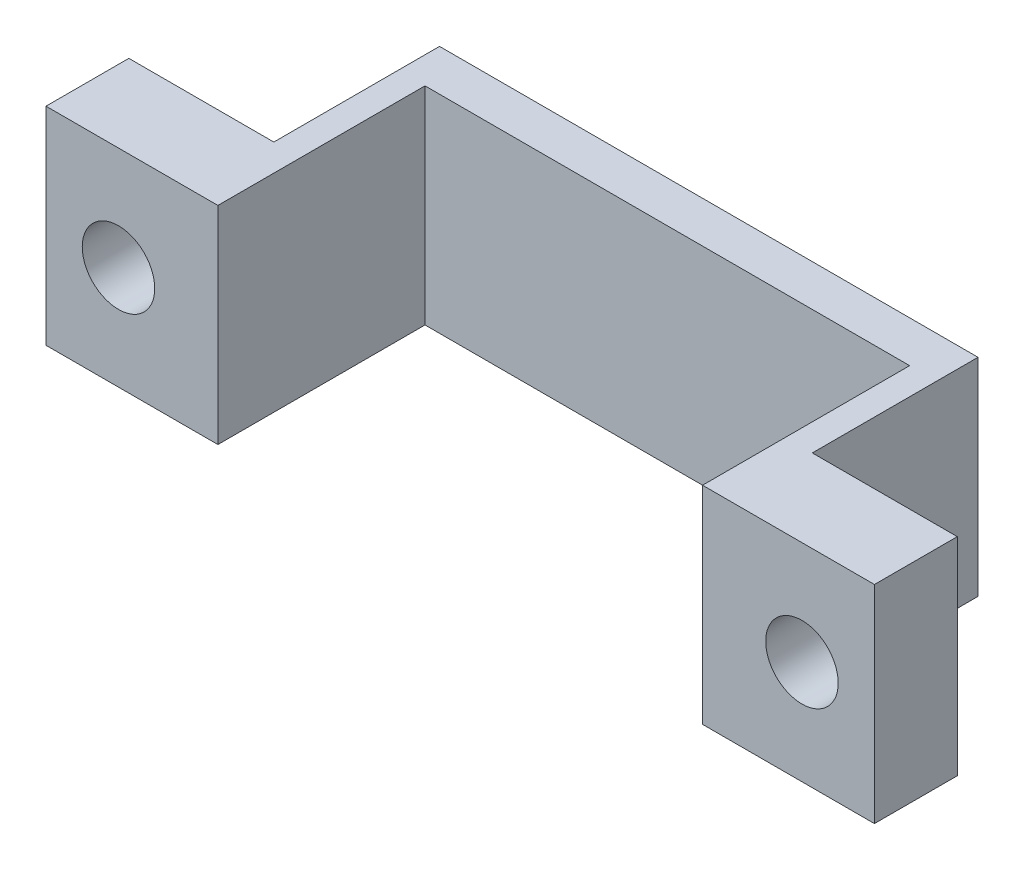
from build123d import *

# Parameters (mm, degrees)
EXTRUDE_1_DEPTH     = 10
SKETCH_3_R          = 1.75
CUT_EXTRUDE_2_DEPTH = 4


with BuildPart() as part:
    # Эскиз1 → Бобышка-Вытянуть1 (new body)
    with BuildSketch(Plane(origin=(0, 0, 0), x_dir=(1, 0, 0), z_dir=(0, 1, 0))):
        Polygon((-13, 2), (13, 2), (13, -6), (20, -6), (20, -10), (11.7, -10), (11.7, 0), (-11.7, 0), (-11.7, -10), (-20, -10), (-20, -6), (-13, -6), align=None)
    extrude(amount=EXTRUDE_1_DEPTH)

    # Эскиз3 → Вырез-Вытянуть2 (cut)
    with BuildSketch(Plane(origin=(0, 0, 6), x_dir=(-1, 0, 0), z_dir=(0, 0, -1))):
        with Locations((16.5, 5)):
            Circle(SKETCH_3_R)
    cut_extrude_2 = extrude(amount=-CUT_EXTRUDE_2_DEPTH, mode=Mode.SUBTRACT)

    # Зеркальное отражение1: Вырез-Вытянуть2 across plane
    add(cut_extrude_2.mirror(Plane.ZY), mode=Mode.SUBTRACT)


solid = part.part
